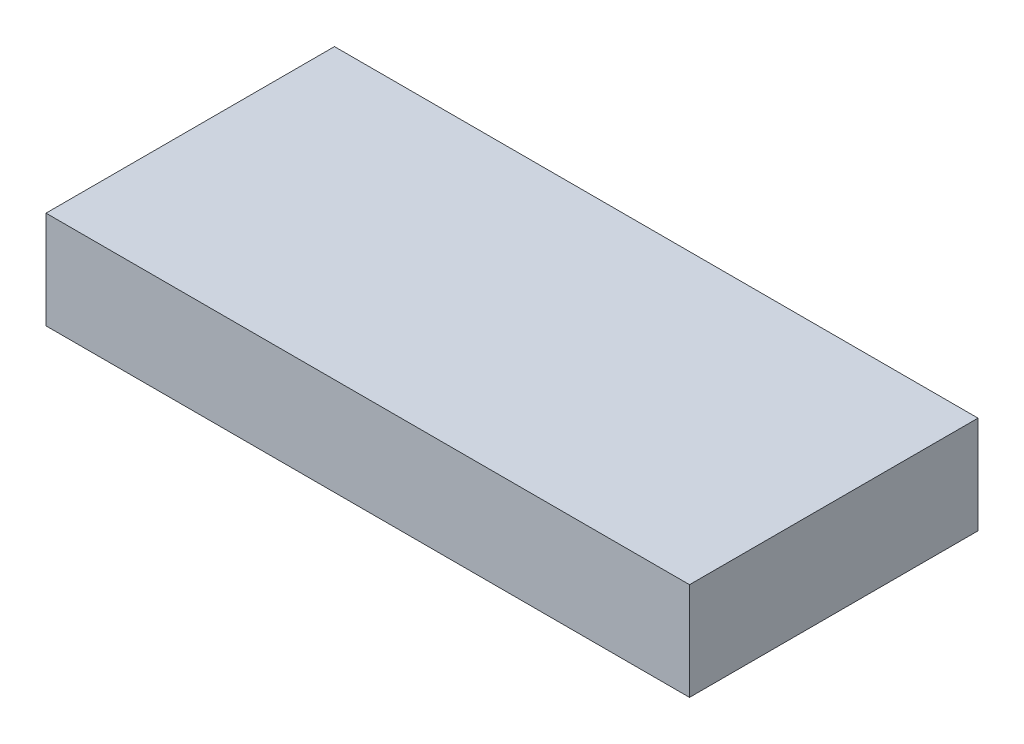
from build123d import *

# Parameters (mm, degrees)
SKETCH1_W           = 145
SKETCH1_H           = 65
BOSS_EXTRUDE1_DEPTH = 11


with BuildPart() as part:
    # Sketch1 → Boss-Extrude1 (new, symmetric)
    with BuildSketch(Plane(origin=(0, 0, 0), x_dir=(1, 0, 0), z_dir=(0, 1, 0))):
        Rectangle(SKETCH1_W, SKETCH1_H)
    extrude(amount=BOSS_EXTRUDE1_DEPTH, both=True)


solid = part.part
